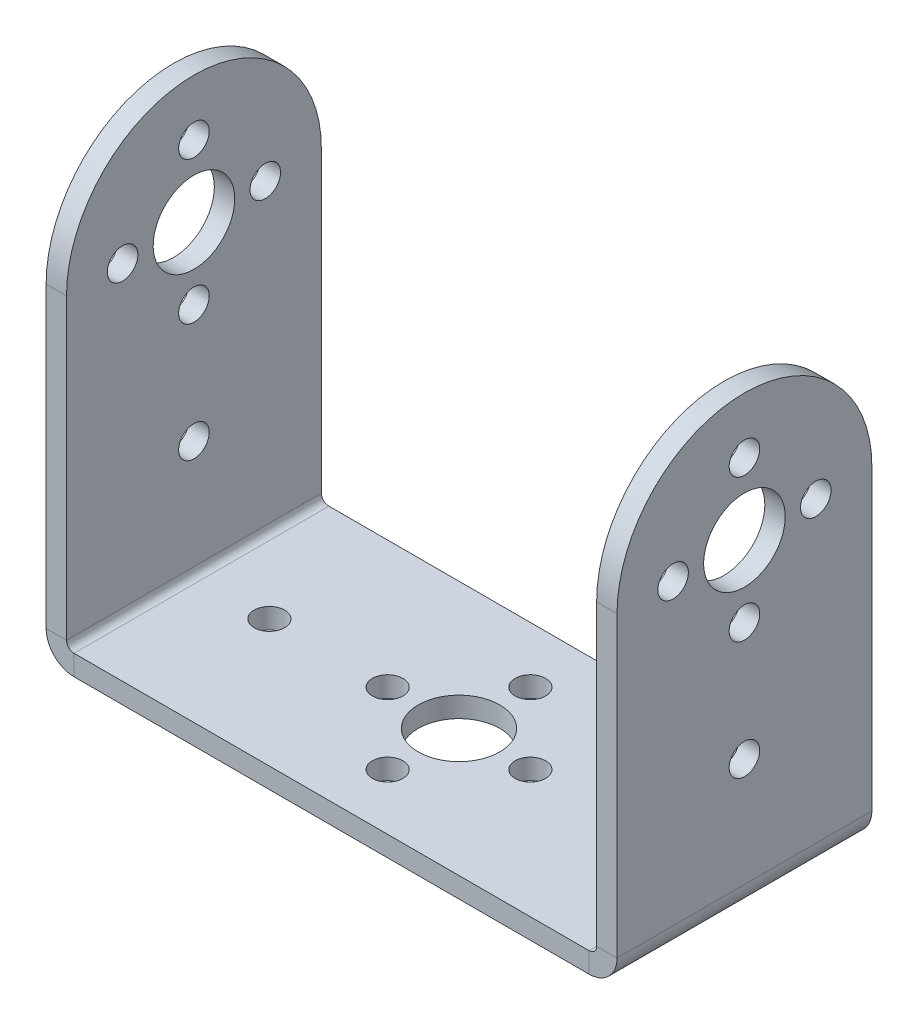
from build123d import *

# Parameters (mm, degrees)
SKETCH_1_W                       = 52
SKETCH_1_H                       = 25
SM_BASE_FLANGE_1_DEPTH           = 2
SM_EDGE_FLANGE_1_STRIP_W         = 9.4732
SM_EDGE_FLANGE_1_STRIP_H         = 2
SM_EDGE_FLANGE_1_STRIP_CUT_DEPTH = 25
SM_EDGE_FLANGE_1_DEPTH           = 25
SM_START                         = 2
SM_EDGE_FLANGE_1_FLAT_DEPTH      = 2
HOLE_WIZARD_3_0_3_1_D            = 3
HOLE_WIZARD_8_0_8_1_D            = 8
HOLE_WIZARD_3_0_3_2_D            = 3
HOLE_WIZARD_8_0_8_2_D            = 8


# Sheet-metal steps are written as plain solids
with BuildPart() as part:
    # Sketch 1 → 基体-法兰1 (new body)
    with BuildSketch(Plane(origin=(0, 0, 0), x_dir=(1, 0, 0), z_dir=(0, 1, 0))):
        Rectangle(SKETCH_1_W, SKETCH_1_H)
    extrude(amount=-SM_BASE_FLANGE_1_DEPTH)

    # 边线-法兰1 strip (across the edge) → 边线-法兰1 strip cut (cut)
    with BuildSketch(Plane(origin=(26, 0, 12.5), x_dir=(-1, 0, 0), z_dir=(0, 0, -1))):
        with Locations((-4, -1)):
            Rectangle(SM_EDGE_FLANGE_1_STRIP_W, SM_EDGE_FLANGE_1_STRIP_H)
    sm_edge_flange_1_strip_cut = extrude(amount=SM_EDGE_FLANGE_1_STRIP_CUT_DEPTH, mode=Mode.SUBTRACT)

    # 边线-法兰1 bend section (across the edge) → 边线-法兰1 (add)
    with BuildSketch(Plane(origin=(26, 0, 12.5), x_dir=(-1, 0, 0), z_dir=(0, 0, -1))):
        with BuildLine():
            Line((-2, 0.7366), (0, 0.7366))
            ThreePointArc((0, 0.7366), (0.215745145, 0.215745145), (0.7366, 0))
            Line((0.7366, 0), (0.7366, -2))
            ThreePointArc((0.7366, -2), (-1.198468417, -1.198468417), (-2, 0.7366))
        make_face()
    sm_edge_flange_1 = extrude(amount=SM_EDGE_FLANGE_1_DEPTH)

    # 边线-法兰1 profile (on flange) → 边线-法兰1 flat (add)
    with BuildSketch(Plane(origin=(26, 0, 0), x_dir=(0, 0, -1), z_dir=(1, 0, 0)).offset(SM_START)):
        with BuildLine():
            Line((-12.5, 30), (-12.5, 0.7366))
            Line((-12.5, 0.7366), (12.5, 0.7366))
            Line((12.5, 0.7366), (12.5, 30))
            ThreePointArc((12.5, 30), (0, 42.5), (-12.5, 30))
        make_face()
    sm_edge_flange_1_flat = extrude(amount=-SM_EDGE_FLANGE_1_FLAT_DEPTH)

    # 镜向1: 边线-法兰1 strip cut, 边线-法兰1, 边线-法兰1 flat across plane
    add(sm_edge_flange_1_strip_cut.mirror(Plane(origin=(0, 0, 0), x_dir=(0, 0, 1), z_dir=(1, 0, 0))), mode=Mode.SUBTRACT)
    add(sm_edge_flange_1.mirror(Plane(origin=(0, 0, 0), x_dir=(0, 0, 1), z_dir=(1, 0, 0))))
    add(sm_edge_flange_1_flat.mirror(Plane(origin=(0, 0, 0), x_dir=(0, 0, 1), z_dir=(1, 0, 0))))

    # Ø3.0 (3) 直径孔1 (through all)
    with Locations(Plane(origin=(0, -2, 0), x_dir=(-1, 0, 0), z_dir=(0, -1, 0))):
        with Locations((0, -7), (0, 7), (-7, 0), (7, 0), (18.6, 0), (-18.6, 0)):
            Hole(HOLE_WIZARD_3_0_3_1_D / 2)

    # Ø8.0 (8) 直径孔1 (through all)
    with Locations(Plane(origin=(0, -2, 0), x_dir=(-1, 0, 0), z_dir=(0, -1, 0))):
        with Locations((0, 0)):
            Hole(HOLE_WIZARD_8_0_8_1_D / 2)

    # Ø3.0 (3) 直径孔2 (through all)
    with Locations(Plane(origin=(28, 0, 0), x_dir=(0, 0, -1), z_dir=(1, 0, 0))):
        with Locations((0, 11.4), (0, 37), (7, 30), (-7, 30), (0, 23)):
            Hole(HOLE_WIZARD_3_0_3_2_D / 2)

    # Ø8.0 (8) 直径孔2 (through all)
    with Locations(Plane(origin=(28, 0, 0), x_dir=(0, 0, -1), z_dir=(1, 0, 0))):
        with Locations((0, 30)):
            Hole(HOLE_WIZARD_8_0_8_2_D / 2)


solid = part.part
